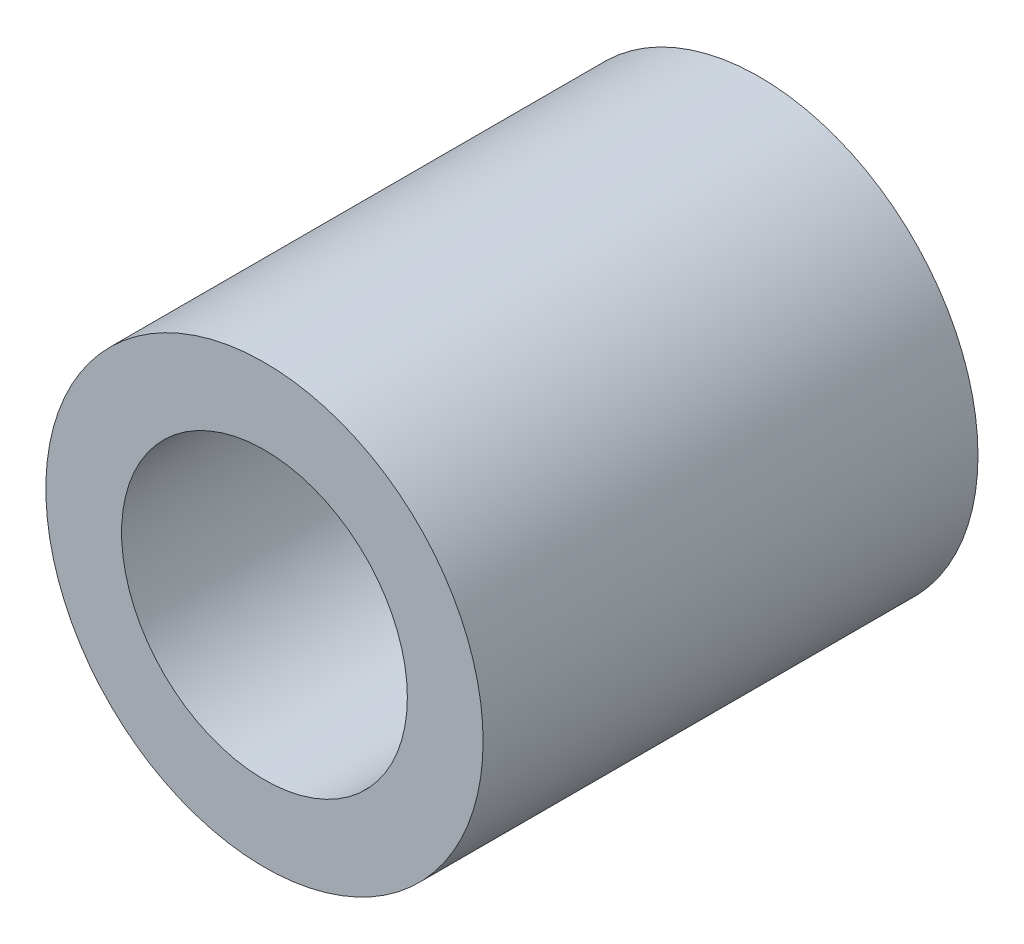
from build123d import *

# Parameters (mm, degrees)
SKETCH1_R           = 16.831388628
SKETCH1_R_2         = 11
BOSS_EXTRUDE1_DEPTH = 38.1


with BuildPart() as part:
    # Sketch1 → Boss-Extrude1 (new body)
    with BuildSketch(Plane.XY):
        Circle(SKETCH1_R)
        Circle(SKETCH1_R_2, mode=Mode.SUBTRACT)
    extrude(amount=-BOSS_EXTRUDE1_DEPTH)


solid = part.part
